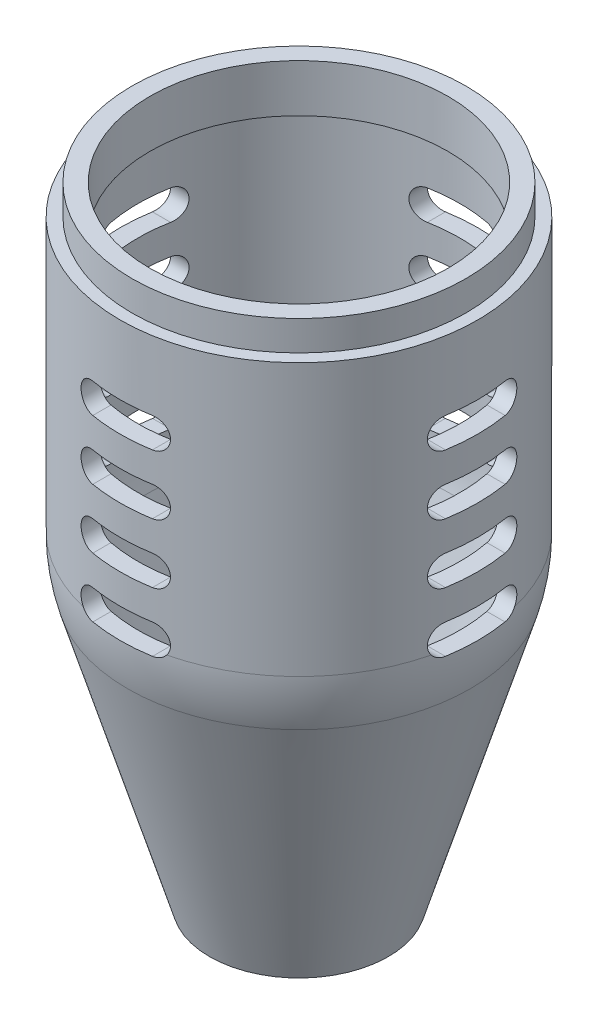
from build123d import *
from build123d.topology import SkipClean

# Parameters (mm, degrees)
SKETCH2_R                = 28
SKETCH2_R_2              = 25
EXTRUDE_THIN1_DEPTH      = 5
CUT_EXTRUDE1_DEPTH       = 114.247516529
LPATTERN6_COUNT          = 4
LPATTERN6_PITCH          = 10
CIRPATTERN1_COUNT        = 4
CIRPATTERN1_COPY_1_DEPTH = 114.247516529
CIRPATTERN1_COPY_2_DEPTH = 114.247516529
CIRPATTERN1_COPY_3_DEPTH = 114.247516529
CIRPATTERN1_COPY_4_DEPTH = 114.247516529
CIRPATTERN1_COPY_5_DEPTH = 114.247516529
CIRPATTERN1_COPY_6_DEPTH = 114.247516529
CIRPATTERN1_COPY_7_DEPTH = 114.247516529
CIRPATTERN1_COPY_8_DEPTH = 114.247516529
CIRPATTERN1_COPY_9_DEPTH = 114.247516529


# Read off the part's stored shape, not the designer's step: Shell2
with BuildPart() as part:
    # Sketch1 → Revolve1 (revolve)
    with BuildSketch(Plane.XY, mode=Mode.PRIVATE) as revolve1_sk:
        with BuildLine():
            Line((0, 0), (0, 100))
            Line((0, 100), (30, 100))
            Line((30, 100), (30, 54.403065089))
            ThreePointArc((30, 54.403065089), (29.682011865, 50.046670749), (28.734788557, 45.782628522))
            Line((28.734788557, 45.782628522), (15, 0))
            Line((15, 0), (0, 0))
        make_face()
    revolve(revolve1_sk.sketch.rotate(Axis((0, 126.662122273, 0), (0, -1, 0)), 90), axis=Axis((0, 126.662122273, 0), (0, -1, 0)))

    # Sketch2 → Extrude-Thin1 (add)
    with BuildSketch(Plane(origin=(0, 100, 0), x_dir=(-1, 0, 0), z_dir=(0, 1, 0))):
        Circle(SKETCH2_R)
        Circle(SKETCH2_R_2, mode=Mode.SUBTRACT)
    extrude(amount=EXTRUDE_THIN1_DEPTH)

    # Shell2 outline → Shell2 (revolve, cut)
    with SkipClean():  # the faces are left unmerged after this step: merging them gives an invalid solid
        with BuildSketch(Plane.XY):
            with BuildLine():
                Line((25, 97), (25, 100))
                Line((25, 100), (0, 100))
                Line((0, 100), (0, 0))
                Line((0, 0), (11.867908047, 0))
                Line((11.867908047, 0), (25.861309693, 46.644672153))
                ThreePointArc((25.861309693, 46.644672153), (26.713810678, 50.482310183), (27, 54.403065116))
                Line((27, 54.403065116), (27, 97))
                Line((27, 97), (25, 97))
            make_face()
        revolve(axis=Axis((0, 0, 0), (0, 1, 0)), mode=Mode.SUBTRACT)

    # Sketch3 → Cut-Extrude1 (cut, through all)
    with SkipClean():  # the faces are left unmerged after this step: merging them gives an invalid solid
        with BuildSketch(Plane.XY):
            with BuildLine():
                Line((-5, 88.415363446), (5, 88.415363446))
                ThreePointArc((5, 88.415363446), (7.5, 85.915363446), (5, 83.415363446))
                Line((5, 83.415363446), (-5, 83.415363446))
                ThreePointArc((-5, 83.415363446), (-7.5, 85.915363446), (-5, 88.415363446))
            make_face()
        cut_extrude1 = extrude(amount=-CUT_EXTRUDE1_DEPTH, mode=Mode.SUBTRACT)

    # LPattern6: Cut-Extrude1 ×4
    with SkipClean():  # the faces are left unmerged after this step: merging them gives an invalid solid
        with Locations(*[(0, -i * LPATTERN6_PITCH, 0) for i in range(1, LPATTERN6_COUNT)]):
            add(cut_extrude1, mode=Mode.SUBTRACT)

    # CirPattern1: Cut-Extrude1 ×4 about axis
    with SkipClean():  # the faces are left unmerged after this step: merging them gives an invalid solid
        cirpattern1_axis = Axis((0, 0, 0), (0, -1, 0))
        for i in range(1, CIRPATTERN1_COUNT):
            add(cut_extrude1.rotate(cirpattern1_axis, i * 360 / CIRPATTERN1_COUNT), mode=Mode.SUBTRACT)

    # CirPattern1 copy 1 sketch → CirPattern1 copy 1 (cut, through all)
    with SkipClean():  # the faces are left unmerged after this step: merging them gives an invalid solid
        with BuildSketch(Plane(origin=(0, -10, 0), x_dir=(0, 0, 1), z_dir=(-1, 0, 0))):
            with BuildLine():
                Line((-5, 88.415363446), (5, 88.415363446))
                ThreePointArc((5, 88.415363446), (7.5, 85.915363446), (5, 83.415363446))
                Line((5, 83.415363446), (-5, 83.415363446))
                ThreePointArc((-5, 83.415363446), (-7.5, 85.915363446), (-5, 88.415363446))
            make_face()
        extrude(amount=-CIRPATTERN1_COPY_1_DEPTH, mode=Mode.SUBTRACT)

    # CirPattern1 copy 2 sketch → CirPattern1 copy 2 (cut, through all)
    with SkipClean():  # the faces are left unmerged after this step: merging them gives an invalid solid
        with BuildSketch(Plane(origin=(0, -10, 0), x_dir=(-1, 0, 0), z_dir=(0, 0, -1))):
            with BuildLine():
                Line((-5, 88.415363446), (5, 88.415363446))
                ThreePointArc((5, 88.415363446), (7.5, 85.915363446), (5, 83.415363446))
                Line((5, 83.415363446), (-5, 83.415363446))
                ThreePointArc((-5, 83.415363446), (-7.5, 85.915363446), (-5, 88.415363446))
            make_face()
        extrude(amount=-CIRPATTERN1_COPY_2_DEPTH, mode=Mode.SUBTRACT)

    # CirPattern1 copy 3 sketch → CirPattern1 copy 3 (cut, through all)
    with SkipClean():  # the faces are left unmerged after this step: merging them gives an invalid solid
        with BuildSketch(Plane(origin=(0, -10, 0), x_dir=(0, 0, -1), z_dir=(1, 0, 0))):
            with BuildLine():
                Line((-5, 88.415363446), (5, 88.415363446))
                ThreePointArc((5, 88.415363446), (7.5, 85.915363446), (5, 83.415363446))
                Line((5, 83.415363446), (-5, 83.415363446))
                ThreePointArc((-5, 83.415363446), (-7.5, 85.915363446), (-5, 88.415363446))
            make_face()
        extrude(amount=-CIRPATTERN1_COPY_3_DEPTH, mode=Mode.SUBTRACT)

    # CirPattern1 copy 4 sketch → CirPattern1 copy 4 (cut, through all)
    with SkipClean():  # the faces are left unmerged after this step: merging them gives an invalid solid
        with BuildSketch(Plane(origin=(0, -20, 0), x_dir=(0, 0, 1), z_dir=(-1, 0, 0))):
            with BuildLine():
                Line((-5, 88.415363446), (5, 88.415363446))
                ThreePointArc((5, 88.415363446), (7.5, 85.915363446), (5, 83.415363446))
                Line((5, 83.415363446), (-5, 83.415363446))
                ThreePointArc((-5, 83.415363446), (-7.5, 85.915363446), (-5, 88.415363446))
            make_face()
        extrude(amount=-CIRPATTERN1_COPY_4_DEPTH, mode=Mode.SUBTRACT)

    # CirPattern1 copy 5 sketch → CirPattern1 copy 5 (cut, through all)
    with SkipClean():  # the faces are left unmerged after this step: merging them gives an invalid solid
        with BuildSketch(Plane(origin=(0, -20, 0), x_dir=(-1, 0, 0), z_dir=(0, 0, -1))):
            with BuildLine():
                Line((-5, 88.415363446), (5, 88.415363446))
                ThreePointArc((5, 88.415363446), (7.5, 85.915363446), (5, 83.415363446))
                Line((5, 83.415363446), (-5, 83.415363446))
                ThreePointArc((-5, 83.415363446), (-7.5, 85.915363446), (-5, 88.415363446))
            make_face()
        extrude(amount=-CIRPATTERN1_COPY_5_DEPTH, mode=Mode.SUBTRACT)

    # CirPattern1 copy 6 sketch → CirPattern1 copy 6 (cut, through all)
    with SkipClean():  # the faces are left unmerged after this step: merging them gives an invalid solid
        with BuildSketch(Plane(origin=(0, -20, 0), x_dir=(0, 0, -1), z_dir=(1, 0, 0))):
            with BuildLine():
                Line((-5, 88.415363446), (5, 88.415363446))
                ThreePointArc((5, 88.415363446), (7.5, 85.915363446), (5, 83.415363446))
                Line((5, 83.415363446), (-5, 83.415363446))
                ThreePointArc((-5, 83.415363446), (-7.5, 85.915363446), (-5, 88.415363446))
            make_face()
        extrude(amount=-CIRPATTERN1_COPY_6_DEPTH, mode=Mode.SUBTRACT)

    # CirPattern1 copy 7 sketch → CirPattern1 copy 7 (cut, through all)
    with SkipClean():  # the faces are left unmerged after this step: merging them gives an invalid solid
        with BuildSketch(Plane(origin=(0, -30, 0), x_dir=(0, 0, 1), z_dir=(-1, 0, 0))):
            with BuildLine():
                Line((-5, 88.415363446), (5, 88.415363446))
                ThreePointArc((5, 88.415363446), (7.5, 85.915363446), (5, 83.415363446))
                Line((5, 83.415363446), (-5, 83.415363446))
                ThreePointArc((-5, 83.415363446), (-7.5, 85.915363446), (-5, 88.415363446))
            make_face()
        extrude(amount=-CIRPATTERN1_COPY_7_DEPTH, mode=Mode.SUBTRACT)

    # CirPattern1 copy 8 sketch → CirPattern1 copy 8 (cut, through all)
    with SkipClean():  # the faces are left unmerged after this step: merging them gives an invalid solid
        with BuildSketch(Plane(origin=(0, -30, 0), x_dir=(-1, 0, 0), z_dir=(0, 0, -1))):
            with BuildLine():
                Line((-5, 88.415363446), (5, 88.415363446))
                ThreePointArc((5, 88.415363446), (7.5, 85.915363446), (5, 83.415363446))
                Line((5, 83.415363446), (-5, 83.415363446))
                ThreePointArc((-5, 83.415363446), (-7.5, 85.915363446), (-5, 88.415363446))
            make_face()
        extrude(amount=-CIRPATTERN1_COPY_8_DEPTH, mode=Mode.SUBTRACT)

    # CirPattern1 copy 9 sketch → CirPattern1 copy 9 (cut, through all)
    with SkipClean():  # the faces are left unmerged after this step: merging them gives an invalid solid
        with BuildSketch(Plane(origin=(0, -30, 0), x_dir=(0, 0, -1), z_dir=(1, 0, 0))):
            with BuildLine():
                Line((-5, 88.415363446), (5, 88.415363446))
                ThreePointArc((5, 88.415363446), (7.5, 85.915363446), (5, 83.415363446))
                Line((5, 83.415363446), (-5, 83.415363446))
                ThreePointArc((-5, 83.415363446), (-7.5, 85.915363446), (-5, 88.415363446))
            make_face()
        extrude(amount=-CIRPATTERN1_COPY_9_DEPTH, mode=Mode.SUBTRACT)


solid = part.part
